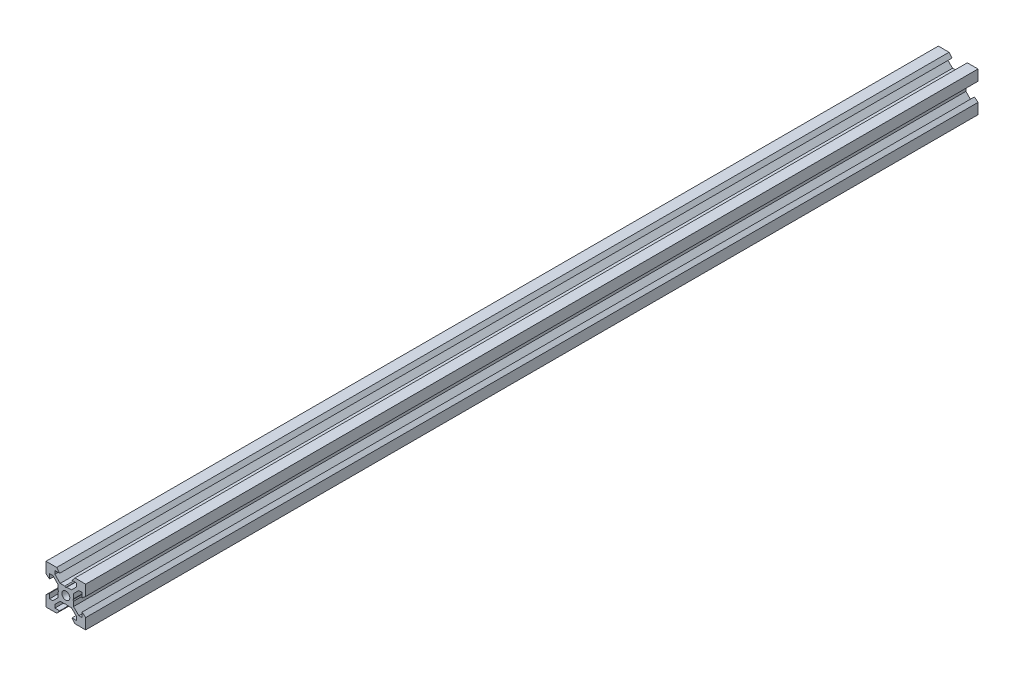
from build123d import *

# Parameters (mm, degrees)
SKETCH1_R           = 2
BOSS_EXTRUDE1_DEPTH = 450


with BuildPart() as part:
    # Sketch1 → Boss-Extrude1 (new body)
    with BuildSketch(Plane.XY):
        Polygon((10, 4.610379336), (10, 10), (4.610379336, 10), (3.1, 8.2), (5.5, 8.2), (5.5, 6.560660172), (2.839339828, 3.9), (0.519615242, 3.9), (0, 3.6), (-0.519615242, 3.9), (-2.839339828, 3.9), (-5.5, 6.560660172), (-5.5, 8.2), (-3.1, 8.2), (-4.610379336, 10), (-10, 10), (-10, 4.610379336), (-8.2, 3.1), (-8.2, 5.5), (-6.560660172, 5.5), (-3.9, 2.839339828), (-3.9, 0.519615242), (-3.6, 0), (-3.9, -0.519615242), (-3.9, -2.839339828), (-6.560660172, -5.5), (-8.2, -5.5), (-8.2, -3.1), (-10, -4.610379336), (-10, -10), (-4.610379336, -10), (-3.1, -8.2), (-5.5, -8.2), (-5.5, -6.560660172), (-2.839339828, -3.9), (-0.519615242, -3.9), (0, -3.6), (0.519615242, -3.9), (2.839339828, -3.9), (5.5, -6.560660172), (5.5, -8.2), (3.1, -8.2), (4.610379336, -10), (10, -10), (10, -4.610379336), (8.2, -3.1), (8.2, -5.5), (6.560660172, -5.5), (3.9, -2.839339828), (3.9, -0.519615242), (3.6, 0), (3.9, 0.519615242), (3.9, 2.839339828), (6.560660172, 5.5), (8.2, 5.5), (8.2, 3.1), align=None)
        Circle(SKETCH1_R, mode=Mode.SUBTRACT)
    extrude(amount=BOSS_EXTRUDE1_DEPTH)


solid = part.part
